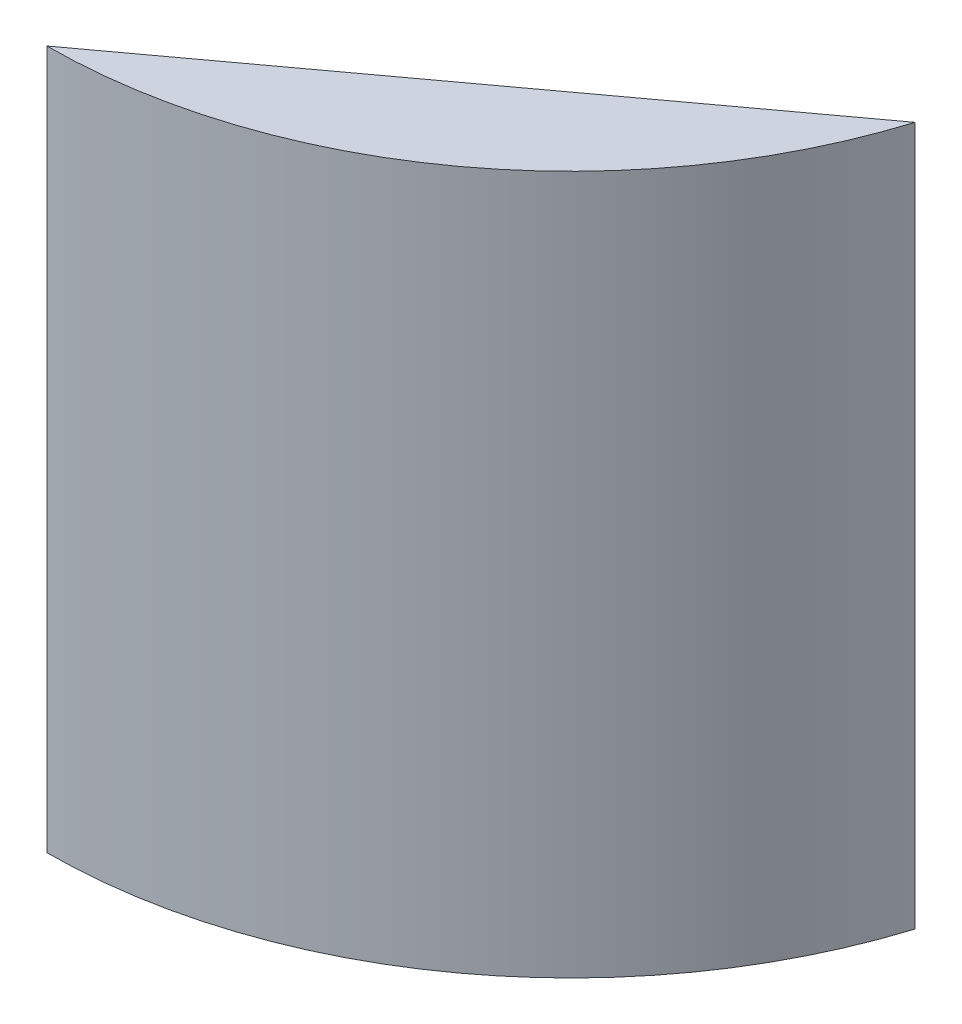
from build123d import *

# Parameters (mm, degrees)
SKETCH1_R           = 85.725
BOSS_EXTRUDE1_DEPTH = 114.3
CUT_EXTRUDE1_DEPTH  = 152.4
SKETCH3_R           = 2.778125
CUT_EXTRUDE2_DEPTH  = 7.9375
SKETCH4_R           = 5.588
CUT_EXTRUDE3_DEPTH  = 6.096


with BuildPart() as part:
    # Sketch1 → Boss-Extrude1 (new body)
    with BuildSketch(Plane(origin=(0, 0, 0), x_dir=(1, 0, 0), z_dir=(0, 1, 0))):
        Circle(SKETCH1_R)
    extrude(amount=BOSS_EXTRUDE1_DEPTH)

    # Sketch2 → Cut-Extrude1 (cut)
    with BuildSketch(Plane(origin=(0, 114.3, 0), x_dir=(1, 0, 0), z_dir=(0, 1, 0))):
        Polygon((0, -85.725), (81.83903771, -25.517592593), (151.304734273, 75.062868172), (-38.51393236, 115.934796391), (-149.339737724, 18.86396687), (-68.774879215, -104.537816407), align=None)
    extrude(amount=-CUT_EXTRUDE1_DEPTH, mode=Mode.SUBTRACT)

    # Sketch3 → Cut-Extrude2 (cut)
    with BuildSketch(Plane(origin=(40.919518855, 0, 55.621296296), x_dir=(-0.8055023396641313, 0, 0.5925925925925928), z_dir=(-0.5925925925925928, 0, -0.8055023396641313))):
        with Locations((2.54, 104.14)):
            Circle(SKETCH3_R)
        with Locations((27.94, 104.14)):
            Circle(SKETCH3_R)
        with Locations((2.54, 27.94)):
            Circle(SKETCH3_R)
        with Locations((27.94, 27.94)):
            Circle(SKETCH3_R)
    extrude(amount=-CUT_EXTRUDE2_DEPTH, mode=Mode.SUBTRACT)

    # Sketch4 → Cut-Extrude3 (cut)
    with BuildSketch(Plane(origin=(0, 0, 0), x_dir=(-1, 0, 0), z_dir=(0, -1, 0))):
        with Locations((-45.859759427, -62.336492182)):
            Circle(SKETCH4_R)
    extrude(amount=-CUT_EXTRUDE3_DEPTH, mode=Mode.SUBTRACT)


solid = part.part
